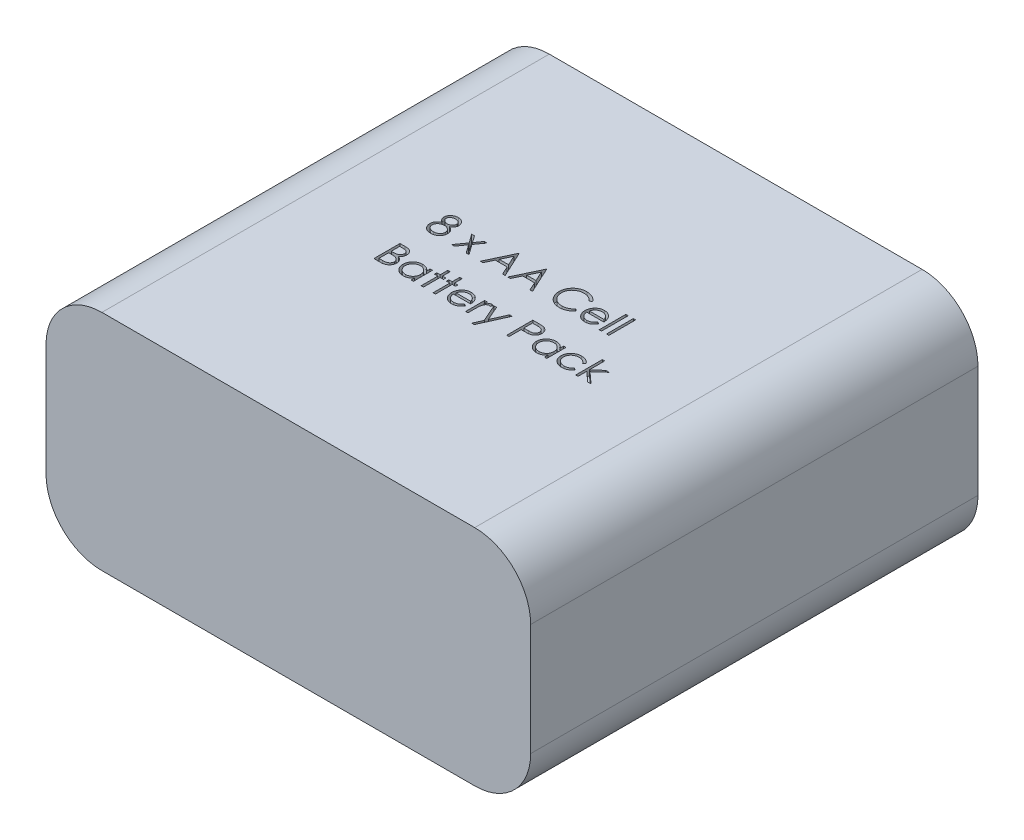
from build123d import *

# Parameters (mm, degrees)
SKETCH1_W           = 65
SKETCH1_H           = 30
BOSS_EXTRUDE1_DEPTH = 60
FILLET1_R           = 7.5
SKETCH2_W           = 0.314102564
SKETCH2_H           = 3.58974359
SKETCH2_W_2         = 0.314102565
CUT_EXTRUDE1_DEPTH  = 1


with BuildPart() as part:
    # Sketch1 → Boss-Extrude1 (new body)
    with BuildSketch(Plane.XY):
        with Locations((32.5, 15)):
            Rectangle(SKETCH1_W, SKETCH1_H)
    extrude(amount=-BOSS_EXTRUDE1_DEPTH)

    # Fillet1
    fillet1_edges = [part.edges().sort_by_distance(p)[0] for p in [
        (0, 0, -30),
        (0, 30, -30),
        (65, 0, -30),
        (65, 30, -30),
    ]]
    fillet(fillet1_edges, radius=FILLET1_R)

    # Sketch2 → Cut-Extrude1 (cut)
    # profile 1 of 19: a face of its own
    with BuildSketch(Plane(origin=(0, 30, 0), x_dir=(1, 0, 0), z_dir=(0, 1, 0))):
        with BuildLine():
            add(Edge.make_bspline(
                [(20.873721371, 33.275930928), (20.902369918, 33.260992972), (20.958244153, 33.23185897), (21.037821361, 33.184948142), (21.110546362, 33.135507177), (21.178436924, 33.085871318), (21.240300275, 33.034139666), (21.295444688, 32.98010651), (21.345232308, 32.925120565), (21.388659092, 32.868250725), (21.426855928, 32.809648075), (21.459868064, 32.749158802), (21.488085266, 32.686915469), (21.510448205, 32.622238639), (21.528869997, 32.556078377), (21.541545602, 32.487580395), (21.54836252, 32.417196054), (21.549651333, 32.369627753), (21.550303903, 32.345542307)],
                knots=[0, 0, 0, 0, 1.272397273, 2.481599622, 3.635517121, 4.734568067, 5.792894095, 6.808321871, 7.773003508, 8.711915296, 9.623354172, 10.525449501, 11.423591555, 12.311487226, 13.218079475, 14.126165749, 15.051214107, 16, 16, 16, 16], degree=3))
            add(Edge.make_bspline(
                [(21.550303903, 32.345542307), (21.549532483, 32.311844574), (21.548005552, 32.245144117), (21.534705568, 32.146698006), (21.514792589, 32.051086224), (21.485713077, 31.958329733), (21.447999686, 31.86894036), (21.40152285, 31.782841586), (21.348911645, 31.698622277), (21.306659406, 31.646802875), (21.285279865, 31.620582371)],
                knots=[0, 0, 0, 0, 1.025265484, 2.029385089, 3.018602448, 3.995076438, 4.983346944, 5.966715145, 6.97116228, 8, 8, 8, 8], degree=3))
            add(Edge.make_bspline(
                [(21.285279865, 31.620582371), (21.25744339, 31.589988597), (21.202114425, 31.529179104), (21.107331497, 31.450228294), (21.003309613, 31.3838789), (20.890451281, 31.329807005), (20.769058179, 31.287721146), (20.639156175, 31.257478628), (20.500492022, 31.240156199), (20.405186551, 31.23765221), (20.356293487, 31.236367627)],
                knots=[0, 0, 0, 0, 0.954267603, 1.896743057, 2.838368354, 3.796610408, 4.779680527, 5.799409237, 6.871065594, 8, 8, 8, 8], degree=3))
            add(Edge.make_bspline(
                [(20.356293487, 31.236367627), (20.309280098, 31.237520105), (20.217796819, 31.23976271), (20.084638941, 31.254957142), (19.960515872, 31.281585008), (19.844705903, 31.318029618), (19.73790721, 31.365439846), (19.640424109, 31.424448255), (19.550850136, 31.492679697), (19.471903663, 31.572093775), (19.401815219, 31.657151647), (19.340247166, 31.744903257), (19.289073087, 31.835356615), (19.245745992, 31.927162982), (19.212577969, 32.021609136), (19.189605759, 32.118209149), (19.175016445, 32.216794292), (19.17307531, 32.283325945), (19.172098775, 32.316796313)],
                knots=[0, 0, 0, 0, 1.256902934, 2.445805442, 3.576955095, 4.645999104, 5.686449165, 6.692658513, 7.68621702, 8.689161843, 9.678783111, 10.630372946, 11.551080876, 12.453998257, 13.34127905, 14.221779781, 15.105423033, 16, 16, 16, 16], degree=3))
            add(Edge.make_bspline(
                [(19.172098775, 32.316796313), (19.172676656, 32.341355505), (19.173818753, 32.389893137), (19.181723601, 32.461602465), (19.194432062, 32.5313986), (19.211691519, 32.599539344), (19.235082546, 32.665528616), (19.263324679, 32.72967909), (19.296256631, 32.792063189), (19.334337796, 32.85302207), (19.37863982, 32.911701582), (19.42880347, 32.969097577), (19.485831339, 33.024319444), (19.549088998, 33.078041869), (19.617853537, 33.131217843), (19.693911068, 33.180973571), (19.775245335, 33.230831536), (19.833050741, 33.260639861), (19.862703743, 33.275930928)],
                knots=[0, 0, 0, 0, 0.941657376, 1.861047343, 2.762797495, 3.66048619, 4.553285746, 5.444104102, 6.34607688, 7.256116206, 8.197091036, 9.162375105, 10.176350973, 11.237807142, 12.343728897, 13.50695164, 14.721116704, 16, 16, 16, 16], degree=3))
            add(Edge.make_bspline(
                [(19.862703743, 33.275930928), (19.822112368, 33.298065697), (19.743516105, 33.340924805), (19.639446664, 33.419671611), (19.550056041, 33.504959426), (19.477801323, 33.59858922), (19.420929095, 33.697636095), (19.381910491, 33.801480347), (19.355514007, 33.908196461), (19.352899179, 33.981102657), (19.351585954, 34.017717787)],
                knots=[0, 0, 0, 0, 1.166880483, 2.259407225, 3.286803203, 4.280235371, 5.237608625, 6.161067461, 7.076446754, 8, 8, 8, 8], degree=3))
            add(Edge.make_bspline(
                [(19.351585954, 34.017717787), (19.353221379, 34.055015346), (19.356508866, 34.129989943), (19.383092187, 34.241596066), (19.426412253, 34.351212631), (19.48533325, 34.458308344), (19.558720466, 34.559258559), (19.646767012, 34.649799505), (19.747370309, 34.729110987), (19.860028176, 34.79568716), (19.981264412, 34.849870819), (20.109180136, 34.887249242), (20.241546629, 34.911685358), (20.331644348, 34.914452013), (20.37732714, 34.915854807)],
                knots=[0, 0, 0, 0, 0.888701115, 1.786444228, 2.72001202, 3.692817113, 4.693886446, 5.687152267, 6.695133018, 7.739871481, 8.800368666, 9.853104506, 10.91144658, 12, 12, 12, 12], degree=3))
            add(Edge.make_bspline(
                [(20.37732714, 34.915854807), (20.421830955, 34.914408464), (20.509587408, 34.91155644), (20.638582036, 34.887769562), (20.762006914, 34.848040042), (20.879436412, 34.794142819), (20.98876828, 34.727755878), (21.085370589, 34.647355004), (21.170703171, 34.557213453), (21.241287565, 34.45629385), (21.299450455, 34.349609656), (21.339951356, 34.237987135), (21.36590333, 34.123838076), (21.369176694, 34.046600072), (21.370816724, 34.007902082)],
                knots=[0, 0, 0, 0, 1.072916533, 2.115669174, 3.151510826, 4.193348718, 5.225979165, 6.227137561, 7.216255879, 8.211077061, 9.189680878, 10.138522389, 11.067357538, 12, 12, 12, 12], degree=3))
            add(Edge.make_bspline(
                [(21.370816724, 34.007902082), (21.369382163, 33.969925418), (21.366564768, 33.895341409), (21.342864828, 33.786614889), (21.302951514, 33.68479285), (21.248457351, 33.588719898), (21.177431864, 33.5001384), (21.090823131, 33.41792193), (20.989321653, 33.341395102), (20.913060766, 33.298208737), (20.873721371, 33.275930928)],
                knots=[0, 0, 0, 0, 0.975232327, 1.915300861, 2.843280834, 3.77672583, 4.742871857, 5.749627742, 6.839139064, 8, 8, 8, 8], degree=3))
        make_face()
        with BuildLine():
            add(Edge.make_bspline(
                [(20.359799095, 34.556880448), (20.33524829, 34.556229007), (20.287216178, 34.554954505), (20.216787507, 34.548295868), (20.14981514, 34.535342651), (20.085599339, 34.518103939), (20.025020527, 34.494815951), (19.967255973, 34.467420942), (19.913288783, 34.434114876), (19.86246748, 34.396753678), (19.816716705, 34.355660772), (19.776112154, 34.312847054), (19.742384039, 34.267471662), (19.71374293, 34.220663302), (19.692961412, 34.171032726), (19.677397109, 34.120101549), (19.666875717, 34.067226165), (19.666087327, 34.031089655), (19.665688519, 34.012809935)],
                knots=[0, 0, 0, 0, 1.203892937, 2.355340988, 3.463153438, 4.544400666, 5.610487187, 6.640501085, 7.674077295, 8.714426146, 9.728707835, 10.68524104, 11.601827946, 12.495867327, 13.368432065, 14.231010473, 15.105153427, 16, 16, 16, 16], degree=3))
            add(Edge.make_bspline(
                [(19.665688519, 34.012809935), (19.666375885, 33.994529425), (19.667734221, 33.958404512), (19.678239349, 33.905058646), (19.693896204, 33.85263701), (19.718546865, 33.802386099), (19.748113224, 33.752562739), (19.7846047, 33.704412153), (19.828093728, 33.657766769), (19.877121168, 33.613023327), (19.930532706, 33.571124564), (19.987116749, 33.534751383), (20.04616314, 33.504317272), (20.10706521, 33.478987867), (20.170443657, 33.45929793), (20.235910131, 33.445329284), (20.303475633, 33.436647287), (20.349256214, 33.435610266), (20.372419288, 33.435085576)],
                knots=[0, 0, 0, 0, 0.873023192, 1.725219244, 2.590779336, 3.480155217, 4.391973325, 5.357036234, 6.360879153, 7.436073238, 8.526419356, 9.601555421, 10.645666583, 11.697338044, 12.750135903, 13.812665442, 14.89329948, 16, 16, 16, 16], degree=3))
            add(Edge.make_bspline(
                [(20.372419288, 33.435085576), (20.402169392, 33.435958443), (20.461375759, 33.437695556), (20.548655091, 33.45384673), (20.633517735, 33.479252647), (20.71505664, 33.514012614), (20.791161225, 33.557640474), (20.859001293, 33.609873492), (20.917998186, 33.669505589), (20.967538796, 33.735608425), (21.005948643, 33.805960013), (21.03585045, 33.876560306), (21.053311666, 33.948162537), (21.055589233, 33.996129501), (21.05671416, 34.019821153)],
                knots=[0, 0, 0, 0, 1.076279235, 2.141928126, 3.20205304, 4.278698113, 5.344010996, 6.36967002, 7.368914609, 8.37248503, 9.349703398, 10.264243087, 11.142681841, 12, 12, 12, 12], degree=3))
            add(Edge.make_bspline(
                [(21.05671416, 34.019821153), (21.056182262, 34.036449189), (21.055126522, 34.069453457), (21.046426466, 34.118191822), (21.032050633, 34.165821406), (21.012587553, 34.212735676), (20.986977758, 34.258276408), (20.95661357, 34.303159496), (20.919729069, 34.34637526), (20.878332635, 34.388930809), (20.831387227, 34.428314832), (20.778983315, 34.462949543), (20.721389564, 34.492361899), (20.658604614, 34.516250654), (20.59085969, 34.534193004), (20.518466816, 34.547629351), (20.440822369, 34.555202463), (20.387392618, 34.556308988), (20.359799095, 34.556880448)],
                knots=[0, 0, 0, 0, 0.814439003, 1.616544685, 2.417341072, 3.248991801, 4.09997495, 4.973547432, 5.9003056, 6.880240646, 7.880314356, 8.896779544, 9.951930927, 11.043077905, 12.18215768, 13.381699519, 14.647792085, 16, 16, 16, 16], degree=3))
        make_face(mode=Mode.SUBTRACT)
        with BuildLine():
            add(Edge.make_bspline(
                [(20.380131628, 33.076111217), (20.349005842, 33.075557576), (20.287944646, 33.074471466), (20.198487717, 33.062381966), (20.112634552, 33.045552573), (20.030674615, 33.020021734), (19.952642519, 32.986825244), (19.878115836, 32.946890704), (19.807664706, 32.899685261), (19.74226198, 32.845808645), (19.682538651, 32.787749191), (19.630140351, 32.726287056), (19.58564283, 32.662564523), (19.549809579, 32.595772294), (19.520397847, 32.527324683), (19.50108397, 32.455517088), (19.488702258, 32.381729975), (19.487039627, 32.331569876), (19.486201339, 32.306279486)],
                knots=[0, 0, 0, 0, 1.140299081, 2.23698856, 3.303958914, 4.344563908, 5.37730929, 6.408454204, 7.439741482, 8.480804886, 9.510774543, 10.48932336, 11.43758569, 12.353841022, 13.263987381, 14.161954604, 15.073269652, 16, 16, 16, 16], degree=3))
            add(Edge.make_bspline(
                [(19.486201339, 32.306279486), (19.487564598, 32.27484858), (19.490269271, 32.212490397), (19.51172591, 32.120327325), (19.546161446, 32.031106271), (19.594186662, 31.945554318), (19.653654234, 31.865604211), (19.726780702, 31.795915436), (19.80902154, 31.733993957), (19.903159394, 31.683913424), (20.00598786, 31.643918569), (20.117479589, 31.616362606), (20.236034508, 31.598121156), (20.3178941, 31.596282975), (20.359799095, 31.595341986)],
                knots=[0, 0, 0, 0, 0.898778495, 1.783155532, 2.693654817, 3.627872908, 4.583023416, 5.533784346, 6.509005473, 7.520592997, 8.575161974, 9.658835044, 10.801527049, 12, 12, 12, 12], degree=3))
            add(Edge.make_bspline(
                [(20.359799095, 31.595341986), (20.392549463, 31.595970795), (20.456357682, 31.597195915), (20.549443631, 31.608010209), (20.63728818, 31.625159834), (20.719720978, 31.65010338), (20.797664818, 31.680553356), (20.869798172, 31.719725438), (20.937976699, 31.764277761), (20.998840822, 31.817135917), (21.054274031, 31.873615412), (21.102607323, 31.933405455), (21.144564874, 31.994881088), (21.17749583, 32.059431572), (21.203822084, 32.125818487), (21.222745639, 32.194653998), (21.234421854, 32.266149231), (21.23560275, 32.314648302), (21.236201339, 32.33923221)],
                knots=[0, 0, 0, 0, 1.224942928, 2.386581632, 3.501229538, 4.569074225, 5.605009692, 6.626002462, 7.634866581, 8.645888296, 9.63523824, 10.59253846, 11.518950513, 12.414518923, 13.29783783, 14.186679152, 15.080837789, 16, 16, 16, 16], degree=3))
            add(Edge.make_bspline(
                [(21.236201339, 32.33923221), (21.235295491, 32.363109551), (21.233509315, 32.410191496), (21.222172624, 32.479958022), (21.202256747, 32.547360837), (21.17492935, 32.613210843), (21.138548387, 32.676173793), (21.095703517, 32.737889965), (21.044009399, 32.796646409), (20.985596803, 32.852899505), (20.921937842, 32.904915242), (20.854270697, 32.950929681), (20.783116235, 32.989681797), (20.708625024, 33.021198292), (20.630962468, 33.045985762), (20.55018569, 33.063301757), (20.466200115, 33.07420136), (20.409145244, 33.075467406), (20.380131628, 33.076111217)],
                knots=[0, 0, 0, 0, 0.917430815, 1.809013306, 2.70690318, 3.612392954, 4.541220862, 5.495268465, 6.494511384, 7.542276156, 8.608045339, 9.649016899, 10.681629292, 11.715607085, 12.752076957, 13.808767841, 14.885711793, 16, 16, 16, 16], degree=3))
        make_face(mode=Mode.SUBTRACT)
    # profile 2 of 19: a face of its own
    with BuildSketch(Plane(origin=(0, 30, 0), x_dir=(1, 0, 0), z_dir=(0, 1, 0))):
        Polygon((23.210560313, 33.883803525), (23.58425823, 33.883803525), (24.242611595, 32.961127243), (24.900964961, 33.883803525), (25.274662878, 33.883803525), (24.429811115, 32.699608813), (25.409278262, 31.326111217), (25.035580345, 31.326111217), (24.242611595, 32.437389262), (23.449642845, 31.326111217), (23.075944929, 31.326111217), (24.056113198, 32.699608813), align=None)
    # profile 3 of 19: a face of its own
    with BuildSketch(Plane(origin=(0, 30, 0), x_dir=(1, 0, 0), z_dir=(0, 1, 0))):
        Polygon((28.640047493, 34.826111217), (30.255432108, 31.326111217), (29.913985794, 31.326111217), (29.39655791, 32.447906089), (27.809919288, 32.447906089), (27.277767845, 31.326111217), (26.934919288, 31.326111217), (28.595175698, 34.826111217), align=None)
        Polygon((28.614105987, 34.14391971), (27.980291884, 32.806880448), (29.231093166, 32.806880448), align=None, mode=Mode.SUBTRACT)
    # profile 4 of 19: a face of its own
    with BuildSketch(Plane(origin=(0, 30, 0), x_dir=(1, 0, 0), z_dir=(0, 1, 0))):
        Polygon((32.319534672, 34.826111217), (33.934919288, 31.326111217), (33.593472974, 31.326111217), (33.076045089, 32.447906089), (31.489406467, 32.447906089), (30.957255025, 31.326111217), (30.614406467, 31.326111217), (32.274662878, 34.826111217), align=None)
        Polygon((32.293593166, 34.14391971), (31.659779063, 32.806880448), (32.910580345, 32.806880448), align=None, mode=Mode.SUBTRACT)
    # profile 5 of 19: a face of its own
    with BuildSketch(Plane(origin=(0, 30, 0), x_dir=(1, 0, 0), z_dir=(0, 1, 0))):
        with BuildLine():
            Line((39.140047493, 34.183883653), (38.865207749, 33.973547114))
            add(Edge.make_bspline(
                [(38.865207749, 33.973547114), (38.845601861, 33.996913084), (38.806654414, 34.04333), (38.743995212, 34.108509544), (38.678693569, 34.169574806), (38.610774448, 34.226816685), (38.539015328, 34.278233451), (38.465154529, 34.326504554), (38.387956484, 34.369772292), (38.281204749, 34.422235278), (38.141556901, 34.476981433), (37.965762062, 34.522884664), (37.782250964, 34.55210584), (37.657053364, 34.555270682), (37.593372813, 34.556880448)],
                knots=[0, 0, 0, 0, 0.757959112, 1.505699292, 2.245454638, 2.979532153, 3.711538275, 4.438200793, 5.171680507, 5.909471876, 7.393775596, 8.890124382, 10.418191784, 12, 12, 12, 12], degree=3))
            add(Edge.make_bspline(
                [(37.593372813, 34.556880448), (37.558289514, 34.556476485), (37.488448522, 34.555672309), (37.384800048, 34.545063184), (37.283086997, 34.530151974), (37.183375531, 34.508026651), (37.085792572, 34.480054032), (36.98970017, 34.446628618), (36.89648957, 34.405273778), (36.804871332, 34.359565518), (36.717092121, 34.307938073), (36.634037073, 34.251624721), (36.556009105, 34.191255625), (36.482946493, 34.126604519), (36.414774545, 34.057962558), (36.351987234, 33.984598217), (36.294801824, 33.906746043), (36.242084799, 33.825432635), (36.194872065, 33.740894844), (36.155342186, 33.652819773), (36.120337064, 33.56271567), (36.092637821, 33.469564509), (36.070713304, 33.374021744), (36.055585641, 33.275830956), (36.04509717, 33.175197276), (36.044296993, 33.106987963), (36.043893647, 33.072605608)],
                knots=[0, 0, 0, 0, 1.054917814, 2.100044995, 3.131103042, 4.146048494, 5.169673617, 6.183595914, 7.203665975, 8.234915748, 9.262203917, 10.264457458, 11.251630812, 12.227803204, 13.197192746, 14.159520551, 15.12972552, 16.100847026, 17.073214652, 18.039054194, 19.002613845, 19.979014051, 20.95965708, 21.949030935, 22.966165397, 24, 24, 24, 24], degree=3))
            add(Edge.make_bspline(
                [(36.043893647, 33.072605608), (36.045155466, 33.020874288), (36.04763288, 32.919306703), (36.069681214, 32.770536093), (36.103186305, 32.628015419), (36.153401882, 32.492635577), (36.215320933, 32.362727218), (36.293561544, 32.240488365), (36.384178082, 32.124071801), (36.488452501, 32.016228853), (36.602858317, 31.917715128), (36.725606229, 31.830964546), (36.856390517, 31.758649664), (36.993767147, 31.698473717), (37.138793261, 31.652216989), (37.291208063, 31.619652866), (37.450680058, 31.598410685), (37.559649458, 31.596376997), (37.615107589, 31.595341986)],
                knots=[0, 0, 0, 0, 1.029171465, 2.020641659, 2.987623507, 3.938342917, 4.889210282, 5.84687017, 6.821220943, 7.821438502, 8.827599549, 9.822697543, 10.807740252, 11.797342354, 12.80366471, 13.83203677, 14.896651826, 16, 16, 16, 16], degree=3))
            add(Edge.make_bspline(
                [(37.615107589, 31.595341986), (37.676210278, 31.597030766), (37.796474987, 31.600354688), (37.972843013, 31.628513938), (38.141678779, 31.674171855), (38.302991365, 31.738069778), (38.456326012, 31.821135066), (38.601922672, 31.921832943), (38.739904243, 32.041121276), (38.822875525, 32.132204404), (38.865207749, 32.178675319)],
                knots=[0, 0, 0, 0, 1.028121516, 2.023589091, 2.998037872, 3.967518031, 4.937445131, 5.927275754, 6.942489185, 8, 8, 8, 8], degree=3))
            Line((38.865207749, 32.178675319), (39.140047493, 31.970442146))
            add(Edge.make_bspline(
                [(39.140047493, 31.970442146), (39.117929383, 31.941903694), (39.073799108, 31.884963488), (39.002341091, 31.804691778), (38.927063793, 31.729187743), (38.847408083, 31.659060122), (38.764290292, 31.592905656), (38.676217979, 31.532603825), (38.584348947, 31.477312941), (38.488994468, 31.426686016), (38.390255855, 31.381768769), (38.28825142, 31.343315001), (38.183420845, 31.310190112), (38.075759336, 31.282938175), (37.96504358, 31.261667091), (37.851673105, 31.247447416), (37.73540323, 31.237705502), (37.656961809, 31.236817586), (37.617210954, 31.236367627)],
                knots=[0, 0, 0, 0, 0.986787822, 1.968848986, 2.935600012, 3.899624008, 4.868462664, 5.837806735, 6.815139263, 7.798259679, 8.787526145, 9.778297419, 10.776456485, 11.791383307, 12.812564526, 13.85620153, 14.913611965, 16, 16, 16, 16], degree=3))
            add(Edge.make_bspline(
                [(37.617210954, 31.236367627), (37.579567287, 31.23662962), (37.505131597, 31.237147678), (37.395232846, 31.245539845), (37.288243265, 31.256989582), (37.184468639, 31.274229713), (37.083342664, 31.294574053), (36.985782079, 31.32184531), (36.890826869, 31.352394476), (36.798858528, 31.388299463), (36.709798829, 31.428815645), (36.623935017, 31.474607204), (36.541306585, 31.525289069), (36.461101164, 31.579744079), (36.38450358, 31.639721381), (36.310850055, 31.704388016), (36.239727579, 31.773526027), (36.195724894, 31.82338088), (36.173601179, 31.848446954)],
                knots=[0, 0, 0, 0, 1.114604814, 2.203992996, 3.262667896, 4.300477797, 5.318619304, 6.316056647, 7.298880507, 8.271930387, 9.238335007, 10.195173496, 11.151986948, 12.108099108, 13.064862484, 14.031167946, 15.010108607, 16, 16, 16, 16], degree=3))
            add(Edge.make_bspline(
                [(36.173601179, 31.848446954), (36.138165535, 31.891988143), (36.067722058, 31.978544853), (35.977596375, 32.118830835), (35.90044882, 32.265299044), (35.838072899, 32.418718972), (35.789310166, 32.57874636), (35.755528971, 32.745461874), (35.733577366, 32.918709816), (35.731067077, 33.036546605), (35.729791083, 33.096443749)],
                knots=[0, 0, 0, 0, 0.994628077, 1.977248131, 2.950237994, 3.925870899, 4.908910175, 5.911660606, 6.938484602, 8, 8, 8, 8], degree=3))
            add(Edge.make_bspline(
                [(35.729791083, 33.096443749), (35.731346276, 33.159399203), (35.734406022, 33.283260127), (35.760401818, 33.46503408), (35.802220614, 33.639185479), (35.861617503, 33.805389224), (35.936922854, 33.964519504), (36.029949468, 34.115360709), (36.13961661, 34.258877509), (36.265064178, 34.39289226), (36.402631513, 34.515431612), (36.549950327, 34.623237816), (36.706732274, 34.712955332), (36.871250126, 34.787951495), (37.044735807, 34.845595958), (37.226819176, 34.885949144), (37.417158091, 34.911066261), (37.547020517, 34.914241469), (37.613004224, 34.915854807)],
                knots=[0, 0, 0, 0, 1.032925535, 2.032216505, 3.007276963, 3.968222605, 4.92396291, 5.891752235, 6.871517503, 7.883894988, 8.900124299, 9.891468569, 10.874487609, 11.85992873, 12.854644235, 13.869047385, 14.917252991, 16, 16, 16, 16], degree=3))
            add(Edge.make_bspline(
                [(37.613004224, 34.915854807), (37.653218696, 34.915372668), (37.732819193, 34.914418324), (37.850571845, 34.905112182), (37.965214172, 34.889598576), (38.076825154, 34.868482506), (38.185947771, 34.842275185), (38.291748011, 34.808134887), (38.394846698, 34.769098355), (38.494593606, 34.724139889), (38.590510157, 34.673673148), (38.682566475, 34.618257524), (38.770031334, 34.557961719), (38.853520182, 34.493298543), (38.931636393, 34.422899984), (39.006597872, 34.348702388), (39.07585895, 34.268568564), (39.118612145, 34.21216363), (39.140047493, 34.183883653)],
                knots=[0, 0, 0, 0, 1.096760587, 2.17092713, 3.219439832, 4.250915756, 5.268269357, 6.278326846, 7.281116186, 8.274029601, 9.260640565, 10.235837813, 11.203064059, 12.156899882, 13.114053108, 14.069676657, 15.032185724, 16, 16, 16, 16], degree=3))
        make_face()
    # profile 6 of 19: a face of its own
    with BuildSketch(Plane(origin=(0, 30, 0), x_dir=(1, 0, 0), z_dir=(0, 1, 0))):
        with BuildLine():
            Line((41.867411275, 32.133803525), (42.146457749, 31.987269069))
            add(Edge.make_bspline(
                [(42.146457749, 31.987269069), (42.124221154, 31.947825738), (42.080957546, 31.871084635), (42.006556798, 31.765652775), (41.928564725, 31.670805059), (41.843460757, 31.589075405), (41.753791078, 31.51782402), (41.659058423, 31.455486195), (41.558769606, 31.402367675), (41.452919881, 31.357615147), (41.34062033, 31.323205653), (41.221598813, 31.298901432), (41.095627318, 31.283878163), (41.009281138, 31.282133022), (40.965067525, 31.281239422)],
                knots=[0, 0, 0, 0, 1.120438281, 2.179929193, 3.190490725, 4.156257408, 5.095198341, 6.022838206, 6.959905092, 7.901321166, 8.864066838, 9.862729781, 10.905609505, 12, 12, 12, 12], degree=3))
            add(Edge.make_bspline(
                [(40.965067525, 31.281239422), (40.915925547, 31.282386597), (40.820063786, 31.284624404), (40.680524039, 31.303916869), (40.54914462, 31.335389227), (40.425932917, 31.379354769), (40.311190664, 31.436782093), (40.20468981, 31.506741575), (40.105870284, 31.588873829), (40.017846074, 31.683890273), (39.938602192, 31.78557223), (39.868676372, 31.891528115), (39.810218941, 32.001491339), (39.762666331, 32.114761863), (39.724261466, 32.230625757), (39.697494762, 32.350137224), (39.682065014, 32.472972808), (39.679700568, 32.556070144), (39.678509031, 32.597946153)],
                knots=[0, 0, 0, 0, 1.145258523, 2.234067595, 3.276747158, 4.290159414, 5.277019952, 6.260822364, 7.254936242, 8.264827045, 9.274100331, 10.257902744, 11.220704747, 12.172965371, 13.118907548, 14.062713208, 15.023725156, 16, 16, 16, 16], degree=3))
            add(Edge.make_bspline(
                [(39.678509031, 32.597946153), (39.679568173, 32.637240983), (39.681667251, 32.715118148), (39.694898038, 32.830383692), (39.718346331, 32.942412145), (39.750522655, 33.051296593), (39.792073902, 33.156854727), (39.842906121, 33.259150791), (39.903098499, 33.35807593), (39.949571172, 33.420479064), (39.972980185, 33.451912499)],
                knots=[0, 0, 0, 0, 1.024358464, 2.0301432, 3.019427413, 4.004406732, 4.986367066, 5.972626655, 6.978780325, 8, 8, 8, 8], degree=3))
            add(Edge.make_bspline(
                [(39.972980185, 33.451912499), (40.004687868, 33.489781369), (40.067098815, 33.564319519), (40.17265517, 33.662257845), (40.286955366, 33.74430162), (40.408566992, 33.812308757), (40.538903466, 33.863982404), (40.676212757, 33.902489986), (40.822058344, 33.924067997), (40.921763565, 33.92711583), (40.972779865, 33.928675319)],
                knots=[0, 0, 0, 0, 1.030682036, 2.02871468, 2.997146059, 3.962720338, 4.930598197, 5.918074684, 6.934738563, 8, 8, 8, 8], degree=3))
            add(Edge.make_bspline(
                [(40.972779865, 33.928675319), (41.02522747, 33.927321271), (41.128117716, 33.924664935), (41.278149837, 33.900038602), (41.420110554, 33.860986047), (41.553943058, 33.805832257), (41.679660919, 33.734672705), (41.796446968, 33.646530864), (41.906298481, 33.544112776), (41.97020706, 33.465349567), (42.002727781, 33.425269871)],
                knots=[0, 0, 0, 0, 1.056321875, 2.072262726, 3.055038591, 4.01806755, 4.982017516, 5.957941055, 6.960871419, 8, 8, 8, 8], degree=3))
            add(Edge.make_bspline(
                [(42.002727781, 33.425269871), (42.02485472, 33.395066289), (42.068961313, 33.334860171), (42.124208413, 33.236689014), (42.172165808, 33.133978419), (42.210498769, 33.025068122), (42.24153827, 32.911248542), (42.263995089, 32.791705997), (42.277164707, 32.666476086), (42.279753405, 32.58114953), (42.281073134, 32.537649678)],
                knots=[0, 0, 0, 0, 0.94817472, 1.890038105, 2.849395472, 3.817997239, 4.812318967, 5.836947057, 6.897266129, 8, 8, 8, 8], degree=3))
            Line((42.281073134, 32.537649678), (39.992611595, 32.537649678))
            add(Edge.make_bspline(
                [(39.992611595, 32.537649678), (39.994151202, 32.503949214), (39.997178776, 32.43767861), (40.011293919, 32.340707827), (40.033542693, 32.248334485), (40.064811755, 32.161251443), (40.102678601, 32.078321316), (40.149064317, 32.000159279), (40.204403871, 31.927121349), (40.266129571, 31.858554211), (40.334836666, 31.79749345), (40.407119413, 31.742841674), (40.484012978, 31.697036077), (40.564911062, 31.659856187), (40.649682847, 31.630749871), (40.738355042, 31.61088205), (40.830753158, 31.597574944), (40.893738892, 31.596095278), (40.925804704, 31.595341986)],
                knots=[0, 0, 0, 0, 1.094153842, 2.151609401, 3.174256925, 4.172055639, 5.149267565, 6.128595816, 7.11444997, 8.118368179, 9.117203808, 10.09244225, 11.054858984, 12.015122123, 12.976791628, 13.957293641, 14.960065497, 16, 16, 16, 16], degree=3))
            add(Edge.make_bspline(
                [(40.925804704, 31.595341986), (40.957155852, 31.595950043), (41.019362543, 31.597156544), (41.1120034, 31.608888455), (41.203142928, 31.62785873), (41.292403911, 31.65374872), (41.377974757, 31.685325573), (41.457220307, 31.72342843), (41.530100523, 31.765578177), (41.598217489, 31.813787852), (41.664288483, 31.872796039), (41.729830969, 31.94643176), (41.800107622, 32.033519288), (41.844097215, 32.099064954), (41.867411275, 32.133803525)],
                knots=[0, 0, 0, 0, 0.99110716, 1.966546729, 2.947904876, 3.932708344, 4.903319531, 5.828989031, 6.710028674, 7.56322171, 8.463672341, 9.504779593, 10.677557249, 12, 12, 12, 12], degree=3))
        make_face()
        with BuildLine():
            add(Edge.make_bspline(
                [(41.96697057, 32.851752243), (41.955473945, 32.893415116), (41.933346644, 32.973602737), (41.887110279, 33.084643627), (41.835038739, 33.183331528), (41.773417007, 33.268911161), (41.703598282, 33.344914674), (41.622953099, 33.41133326), (41.532517206, 33.470750711), (41.432758065, 33.52090321), (41.32711628, 33.563593069), (41.216510088, 33.592218185), (41.1036523, 33.611827727), (41.027318014, 33.613653835), (40.988905666, 33.614572755)],
                knots=[0, 0, 0, 0, 1.154881502, 2.222775134, 3.210006277, 4.132804581, 5.035138423, 5.962687519, 6.919655026, 7.923214229, 8.944639381, 9.960483929, 10.97369054, 12, 12, 12, 12], degree=3))
            add(Edge.make_bspline(
                [(40.988905666, 33.614572755), (40.957556227, 33.613961084), (40.895584978, 33.612751938), (40.80428391, 33.601281808), (40.716604211, 33.582321964), (40.631898924, 33.556357007), (40.551278055, 33.521748404), (40.473083287, 33.481165178), (40.399302891, 33.431623594), (40.353161595, 33.393864739), (40.329851179, 33.374789102)],
                knots=[0, 0, 0, 0, 1.04873581, 2.073130211, 3.073294108, 4.04793562, 5.032784715, 6.005352987, 6.992311501, 8, 8, 8, 8], degree=3))
            add(Edge.make_bspline(
                [(40.329851179, 33.374789102), (40.313157897, 33.359694786), (40.279374763, 33.32914757), (40.234234241, 33.276518363), (40.191013768, 33.219766801), (40.151680116, 33.156721677), (40.115602529, 33.088100898), (40.081842552, 33.014483262), (40.05145614, 32.935310132), (40.03436003, 32.880137693), (40.02556432, 32.851752243)],
                knots=[0, 0, 0, 0, 0.879870761, 1.780643979, 2.707998968, 3.669668524, 4.684282772, 5.740141944, 6.837334558, 8, 8, 8, 8], degree=3))
            Line((40.02556432, 32.851752243), (41.96697057, 32.851752243))
        make_face(mode=Mode.SUBTRACT)
    # profile 7 of 19: a face of its own
    with BuildSketch(Plane(origin=(0, 30, 0), x_dir=(1, 0, 0), z_dir=(0, 1, 0))):
        with Locations((43.021457749, 33.120983012)):
            Rectangle(SKETCH2_W, SKETCH2_H)
    # profile 8 of 19: a face of its own
    with BuildSketch(Plane(origin=(0, 30, 0), x_dir=(1, 0, 0), z_dir=(0, 1, 0))):
        with Locations((44.008637237, 33.120983012)):
            Rectangle(SKETCH2_W_2, SKETCH2_H)
    # profile 9 of 19: a face of its own
    with BuildSketch(Plane(origin=(0, 30, 0), x_dir=(1, 0, 0), z_dir=(0, 1, 0))):
        with BuildLine():
            Line((19.486201339, 27.992777884), (20.169093967, 27.992777884))
            add(Edge.make_bspline(
                [(20.169093967, 27.992777884), (20.202522445, 27.992602133), (20.267315156, 27.992261485), (20.361534598, 27.986978354), (20.449783408, 27.979774684), (20.532087181, 27.968344591), (20.608407883, 27.954552814), (20.67897552, 27.937850998), (20.743565693, 27.917824385), (20.820678429, 27.885978103), (20.90859909, 27.838654935), (21.003797482, 27.76872637), (21.085201722, 27.683193907), (21.155388039, 27.586711251), (21.211189159, 27.48057548), (21.251558456, 27.367316291), (21.277116331, 27.248394549), (21.279744766, 27.166751371), (21.281073134, 27.125490223)],
                knots=[0, 0, 0, 0, 1.001505555, 1.941167018, 2.826882275, 3.653841531, 4.429895133, 5.150066043, 5.825578002, 6.45369114, 7.647487171, 8.808567382, 9.977351308, 11.170798116, 12.373658725, 13.556498008, 14.765093433, 16, 16, 16, 16], degree=3))
            add(Edge.make_bspline(
                [(21.281073134, 27.125490223), (21.279979915, 27.086837668), (21.277831638, 27.010881751), (21.257288879, 26.899787641), (21.22512821, 26.794036423), (21.180422961, 26.694014037), (21.122320965, 26.601980424), (21.053462646, 26.517193158), (20.970385844, 26.443242101), (20.908142604, 26.401899198), (20.876525858, 26.380898877)],
                knots=[0, 0, 0, 0, 1.044552857, 2.05264487, 3.044412934, 4.028983338, 5.005914585, 5.980388656, 6.974128949, 8, 8, 8, 8], degree=3))
            add(Edge.make_bspline(
                [(20.876525858, 26.380898877), (20.916286286, 26.365633878), (20.992357833, 26.336428154), (21.097043846, 26.28479269), (21.187238691, 26.228630579), (21.263635837, 26.167298729), (21.328973492, 26.101189919), (21.386026433, 26.029334804), (21.434707807, 25.950796046), (21.476420731, 25.866392511), (21.508969487, 25.776986043), (21.533345391, 25.683415267), (21.54731284, 25.586015711), (21.549300482, 25.519730332), (21.550303903, 25.486267467)],
                knots=[0, 0, 0, 0, 1.27268992, 2.434971085, 3.483601985, 4.442670788, 5.356604649, 6.2567628, 7.179492994, 8.113709626, 9.066344395, 10.018646069, 10.999752585, 12, 12, 12, 12], degree=3))
            add(Edge.make_bspline(
                [(21.550303903, 25.486267467), (21.549327057, 25.452100595), (21.547405085, 25.384876317), (21.533225113, 25.286121182), (21.509216006, 25.191746236), (21.47614486, 25.101141053), (21.432982545, 25.014480918), (21.380454581, 24.931667654), (21.317823018, 24.853533324), (21.247760149, 24.779209701), (21.168498003, 24.712381913), (21.082982248, 24.652866207), (20.990135928, 24.603920145), (20.891483934, 24.562804123), (20.785919618, 24.531396925), (20.673917011, 24.509424351), (20.555572709, 24.494619314), (20.474362958, 24.493402109), (20.432715762, 24.492777884)],
                knots=[0, 0, 0, 0, 0.978564426, 1.925352924, 2.850884081, 3.763762016, 4.682927383, 5.618979971, 6.567305752, 7.547517671, 8.540179244, 9.531824382, 10.526200242, 11.540722885, 12.589160233, 13.674978461, 14.80764778, 16, 16, 16, 16], degree=3))
            Line((20.432715762, 24.492777884), (19.486201339, 24.492777884))
            Line((19.486201339, 24.492777884), (19.486201339, 27.992777884))
        make_face()
        with BuildLine():
            Line((19.800303903, 27.633803525), (19.800303903, 26.512008653))
            Line((19.800303903, 26.512008653), (20.011341563, 26.512008653))
            add(Edge.make_bspline(
                [(20.011341563, 26.512008653), (20.042190359, 26.512408576), (20.101796518, 26.513181309), (20.188116415, 26.515394826), (20.268241433, 26.521592869), (20.342033266, 26.527789131), (20.40937571, 26.537863719), (20.470119571, 26.549855842), (20.525218168, 26.562538747), (20.588757714, 26.584108234), (20.660830662, 26.615985909), (20.737663766, 26.665457745), (20.805398236, 26.724382098), (20.862595424, 26.79237306), (20.909406894, 26.867239246), (20.941920609, 26.947786126), (20.963967894, 27.032006258), (20.965959425, 27.089824511), (20.96697057, 27.119180127)],
                knots=[0, 0, 0, 0, 1.156816544, 2.235205308, 3.236616184, 4.169592532, 5.011045266, 5.787822928, 6.49130361, 7.128639758, 8.301311294, 9.436451833, 10.541879658, 11.654887649, 12.756523258, 13.837046038, 14.901820046, 16, 16, 16, 16], degree=3))
            add(Edge.make_bspline(
                [(20.96697057, 27.119180127), (20.96644439, 27.138605899), (20.96541223, 27.176711671), (20.956958927, 27.232261025), (20.942591353, 27.284504777), (20.924137059, 27.334158888), (20.898348371, 27.379670738), (20.867984907, 27.422613934), (20.831299217, 27.461526052), (20.789541905, 27.497895551), (20.741533282, 27.530140078), (20.68730199, 27.558380841), (20.626114313, 27.581121618), (20.559001458, 27.601037771), (20.48493037, 27.615026064), (20.404755817, 27.626679452), (20.317821098, 27.632612194), (20.257675995, 27.633397557), (20.226585954, 27.633803525)],
                knots=[0, 0, 0, 0, 0.91205012, 1.789085906, 2.630437955, 3.453916878, 4.269457761, 5.079663411, 5.91843418, 6.774407191, 7.675494373, 8.627863946, 9.638891023, 10.736472738, 11.911756761, 13.175263542, 14.539845004, 16, 16, 16, 16], degree=3))
            Line((20.226585954, 27.633803525), (19.800303903, 27.633803525))
        make_face(mode=Mode.SUBTRACT)
        with BuildLine():
            Line((19.800303903, 26.153034294), (19.800303903, 24.851752243))
            Line((19.800303903, 24.851752243), (20.247619608, 24.851752243))
            add(Edge.make_bspline(
                [(20.247619608, 24.851752243), (20.279638534, 24.85213599), (20.341350793, 24.852875612), (20.430452023, 24.855290167), (20.513035127, 24.860782443), (20.588723262, 24.869428292), (20.658333715, 24.878806742), (20.721031418, 24.891418022), (20.777324612, 24.905866983), (20.842598919, 24.928201155), (20.916102428, 24.962897626), (20.995313284, 25.015211853), (21.065739502, 25.07753516), (21.125544761, 25.149666075), (21.17455775, 25.228097401), (21.210213205, 25.311242751), (21.232204062, 25.397728279), (21.234866231, 25.456694991), (21.236201339, 25.486267467)],
                knots=[0, 0, 0, 0, 1.160039823, 2.235823828, 3.228722157, 4.157150951, 4.99529583, 5.772374946, 6.472645482, 7.099169577, 8.269452708, 9.405989375, 10.527446681, 11.663510218, 12.788923519, 13.866172445, 14.929861265, 16, 16, 16, 16], degree=3))
            add(Edge.make_bspline(
                [(21.236201339, 25.486267467), (21.235925235, 25.504760807), (21.23537748, 25.541449189), (21.227116865, 25.595365008), (21.215102995, 25.647590882), (21.199571561, 25.698268622), (21.176952094, 25.746481999), (21.150545549, 25.793184558), (21.119584147, 25.838438037), (21.071339981, 25.895650291), (21.001167997, 25.961567304), (20.901461221, 26.026104806), (20.788088923, 26.078152613), (20.705861431, 26.10025209), (20.663384833, 26.111668108)],
                knots=[0, 0, 0, 0, 0.723448775, 1.435228256, 2.130040452, 2.821711965, 3.505591119, 4.210454504, 4.921174351, 5.648778258, 7.137944449, 8.670945889, 10.280296675, 12, 12, 12, 12], degree=3))
            add(Edge.make_bspline(
                [(20.663384833, 26.111668108), (20.646355737, 26.115123192), (20.609433144, 26.122614527), (20.549225564, 26.13052223), (20.480489695, 26.13756729), (20.403066818, 26.142778448), (20.316858977, 26.148164991), (20.221682058, 26.150259812), (20.117924743, 26.152759072), (20.045932371, 26.152940207), (20.008537076, 26.153034294)],
                knots=[0, 0, 0, 0, 0.634451884, 1.375622551, 2.216452059, 3.157844607, 4.20941857, 5.370758133, 6.634282058, 8, 8, 8, 8], degree=3))
            Line((20.008537076, 26.153034294), (19.800303903, 26.153034294))
        make_face(mode=Mode.SUBTRACT)
    # profile 10 of 19: a face of its own
    with BuildSketch(Plane(origin=(0, 30, 0), x_dir=(1, 0, 0), z_dir=(0, 1, 0))):
        with BuildLine():
            Line((24.781073134, 27.050470191), (24.781073134, 24.492777884))
            Line((24.781073134, 24.492777884), (24.46697057, 24.492777884))
            Line((24.46697057, 24.492777884), (24.46697057, 24.935185736))
            add(Edge.make_bspline(
                [(24.46697057, 24.935185736), (24.431551779, 24.895146142), (24.362431564, 24.817008371), (24.246990446, 24.714926199), (24.124622268, 24.630547877), (23.995920947, 24.562397961), (23.861002704, 24.511205905), (23.720166616, 24.474819746), (23.573355235, 24.451425911), (23.473102881, 24.449089889), (23.422299095, 24.447906089)],
                knots=[0, 0, 0, 0, 1.074387032, 2.096679803, 3.090159297, 4.057316773, 5.018401886, 5.985159533, 6.978961417, 8, 8, 8, 8], degree=3))
            add(Edge.make_bspline(
                [(23.422299095, 24.447906089), (23.377131142, 24.449132461), (23.288057937, 24.451550921), (23.15702886, 24.470313225), (23.03093661, 24.500443847), (22.909662038, 24.542344736), (22.793989892, 24.597925558), (22.682929795, 24.664466806), (22.577057103, 24.743707636), (22.477985564, 24.834295664), (22.386753564, 24.932690651), (22.306692291, 25.037636198), (22.239939212, 25.148678502), (22.184119131, 25.264411656), (22.141122786, 25.385726576), (22.111149152, 25.512203744), (22.092408705, 25.643693617), (22.089991245, 25.73323314), (22.088765442, 25.778635255)],
                knots=[0, 0, 0, 0, 1.033919861, 2.038935746, 3.024066025, 3.998881131, 4.97069526, 5.957263378, 6.95902576, 7.993208707, 9.027059324, 10.027763471, 11.009749337, 11.988697705, 12.965288445, 13.950418724, 14.960734635, 16, 16, 16, 16], degree=3))
            add(Edge.make_bspline(
                [(22.088765442, 25.778635255), (22.090018413, 25.823098959), (22.09249547, 25.911001302), (22.11094869, 26.04028), (22.141979698, 26.164798261), (22.185527546, 26.284155204), (22.241369501, 26.398495254), (22.309297588, 26.507899279), (22.389316713, 26.612668677), (22.48156912, 26.710339904), (22.58150389, 26.800560518), (22.688412621, 26.878969563), (22.799635902, 26.946686412), (22.916898913, 27.000339888), (23.038466017, 27.043748993), (23.165419463, 27.073781961), (23.297231042, 27.091479282), (23.386721534, 27.094042047), (23.432114801, 27.095341986)],
                knots=[0, 0, 0, 0, 1.020392517, 2.01726096, 2.990465484, 3.961182959, 4.928053699, 5.906110375, 6.912531644, 7.948652711, 8.985773172, 9.998621852, 10.987621588, 11.969261332, 12.953316658, 13.946091881, 14.958173133, 16, 16, 16, 16], degree=3))
            add(Edge.make_bspline(
                [(23.432114801, 27.095341986), (23.48431466, 27.093904235), (23.58667612, 27.091084872), (23.736404129, 27.067622144), (23.878048607, 27.027983677), (24.012702959, 26.974066179), (24.139883645, 26.90241745), (24.258386629, 26.812037489), (24.369452113, 26.703496302), (24.433832404, 26.620125858), (24.46697057, 26.57721298)],
                knots=[0, 0, 0, 0, 1.038897134, 2.037228247, 3.008116434, 3.962042015, 4.918381754, 5.904844433, 6.921570401, 8, 8, 8, 8], degree=3))
            Line((24.46697057, 26.57721298), (24.46697057, 27.050470191))
            Line((24.46697057, 27.050470191), (24.781073134, 27.050470191))
        make_face()
        with BuildLine():
            add(Edge.make_bspline(
                [(23.436321531, 26.781239422), (23.390407193, 26.779605784), (23.299779594, 26.776381243), (23.166735591, 26.751207748), (23.039422177, 26.709323154), (22.918476103, 26.652041253), (22.805807886, 26.580012516), (22.705114216, 26.492891133), (22.615571514, 26.393054118), (22.54026325, 26.280952008), (22.478872753, 26.160773917), (22.435705721, 26.035149479), (22.407236474, 25.906344501), (22.404327953, 25.818981816), (22.402868006, 25.775129646)],
                knots=[0, 0, 0, 0, 1.031046209, 2.035121221, 3.029706178, 4.034933723, 5.034054252, 6.02443088, 7.017295772, 8.038157696, 9.050218397, 10.03989886, 11.016116709, 12, 12, 12, 12], degree=3))
            add(Edge.make_bspline(
                [(22.402868006, 25.775129646), (22.404732899, 25.731539539), (22.408455376, 25.644530183), (22.43520607, 25.515549607), (22.480085944, 25.389895565), (22.541328006, 25.268634571), (22.618014631, 25.156050471), (22.706903284, 25.054310348), (22.808853565, 24.96682076), (22.921781072, 24.893583186), (23.042389043, 24.834420665), (23.169222974, 24.793255026), (23.299898612, 24.766677245), (23.388750946, 24.763572768), (23.433517044, 24.762008653)],
                knots=[0, 0, 0, 0, 0.979072187, 1.954306742, 2.945804271, 3.96968567, 4.997920485, 5.998718438, 6.996577872, 8.005894225, 9.015743152, 10.005417472, 10.995077863, 12, 12, 12, 12], degree=3))
            add(Edge.make_bspline(
                [(23.433517044, 24.762008653), (23.478963547, 24.763668617), (23.569352133, 24.76697012), (23.702790841, 24.792251386), (23.832285804, 24.834020184), (23.956073033, 24.891919311), (24.071389164, 24.963676667), (24.174887041, 25.047683758), (24.26240301, 25.145386942), (24.336595619, 25.252763395), (24.394771036, 25.370475391), (24.437147095, 25.495809582), (24.462201001, 25.62877033), (24.465358731, 25.719634257), (24.46697057, 25.766015063)],
                knots=[0, 0, 0, 0, 1.01762866, 2.023962475, 3.030623092, 4.058876274, 5.077231937, 6.066672613, 7.034107872, 8.005628644, 8.981990164, 9.965428785, 10.961468474, 12, 12, 12, 12], degree=3))
            add(Edge.make_bspline(
                [(24.46697057, 25.766015063), (24.466010913, 25.801352894), (24.464122006, 25.870908927), (24.449691437, 25.973036444), (24.42673651, 26.070770171), (24.39439034, 26.16421286), (24.351899056, 26.252847875), (24.30065129, 26.337311635), (24.23974584, 26.417164847), (24.170163144, 26.491307918), (24.093997941, 26.55893438), (24.013403401, 26.619298621), (23.927424654, 26.668887393), (23.837507617, 26.709928665), (23.743496282, 26.742587815), (23.644625663, 26.764375508), (23.541946676, 26.779335829), (23.47190062, 26.78059821), (23.436321531, 26.781239422)],
                knots=[0, 0, 0, 0, 1.050140795, 2.067009409, 3.05949893, 4.030605086, 5.00011959, 5.97591094, 6.962425594, 7.979863591, 8.993523472, 9.986985069, 10.967611495, 11.937549037, 12.921786183, 13.919465291, 14.943216303, 16, 16, 16, 16], degree=3))
        make_face(mode=Mode.SUBTRACT)
    # profile 11 of 19: a face of its own
    with BuildSketch(Plane(origin=(0, 30, 0), x_dir=(1, 0, 0), z_dir=(0, 1, 0))):
        Polygon((25.813124416, 28.082521473), (26.12722698, 28.082521473), (26.12722698, 27.050470191), (26.575944929, 27.050470191), (26.575944929, 26.736367627), (26.12722698, 26.736367627), (26.12722698, 24.492777884), (25.813124416, 24.492777884), (25.813124416, 26.736367627), (25.364406467, 26.736367627), (25.364406467, 27.050470191), (25.813124416, 27.050470191), align=None)
    # profile 12 of 19: a face of its own
    with BuildSketch(Plane(origin=(0, 30, 0), x_dir=(1, 0, 0), z_dir=(0, 1, 0))):
        Polygon((27.428509031, 28.082521473), (27.742611595, 28.082521473), (27.742611595, 27.050470191), (28.191329544, 27.050470191), (28.191329544, 26.736367627), (27.742611595, 26.736367627), (27.742611595, 24.492777884), (27.428509031, 24.492777884), (27.428509031, 26.736367627), (26.979791083, 26.736367627), (26.979791083, 27.050470191), (27.428509031, 27.050470191), align=None)
    # profile 13 of 19: a face of its own
    with BuildSketch(Plane(origin=(0, 30, 0), x_dir=(1, 0, 0), z_dir=(0, 1, 0))):
        with BuildLine():
            Line((30.828949737, 25.300470191), (31.107996211, 25.153935736))
            add(Edge.make_bspline(
                [(31.107996211, 25.153935736), (31.085759616, 25.114492405), (31.042496007, 25.037751302), (30.968095259, 24.932319442), (30.890103187, 24.837471726), (30.804999219, 24.755742071), (30.71532954, 24.684490686), (30.620596885, 24.622152862), (30.520308067, 24.569034341), (30.414458342, 24.524281814), (30.302158791, 24.489872319), (30.183137275, 24.465568099), (30.057165779, 24.45054483), (29.9708196, 24.448799689), (29.926605987, 24.447906089)],
                knots=[0, 0, 0, 0, 1.120438281, 2.179929193, 3.190490725, 4.156257408, 5.095198341, 6.022838206, 6.959905092, 7.901321166, 8.864066838, 9.862729781, 10.905609505, 12, 12, 12, 12], degree=3))
            add(Edge.make_bspline(
                [(29.926605987, 24.447906089), (29.877464009, 24.449053264), (29.781602247, 24.451291071), (29.6420625, 24.470583535), (29.510683082, 24.502055894), (29.387471378, 24.546021435), (29.272729126, 24.603448759), (29.166228271, 24.673408241), (29.067408745, 24.755540496), (28.979384536, 24.850556939), (28.900140653, 24.952238897), (28.830214833, 25.058194781), (28.771757402, 25.168158006), (28.724204792, 25.28142853), (28.685799927, 25.397292423), (28.659033223, 25.516803891), (28.643603475, 25.639639475), (28.64123903, 25.722736811), (28.640047493, 25.764612819)],
                knots=[0, 0, 0, 0, 1.145258523, 2.234067595, 3.276747158, 4.290159414, 5.277019952, 6.260822364, 7.254936242, 8.264827045, 9.274100331, 10.257902744, 11.220704747, 12.172965371, 13.118907548, 14.062713208, 15.023725156, 16, 16, 16, 16], degree=3))
            add(Edge.make_bspline(
                [(28.640047493, 25.764612819), (28.641106634, 25.80390765), (28.643205712, 25.881784815), (28.6564365, 25.997050359), (28.679884793, 26.109078812), (28.712061117, 26.21796326), (28.753612363, 26.323521394), (28.804444582, 26.425817457), (28.86463696, 26.524742597), (28.911109634, 26.587145731), (28.934518647, 26.618579166)],
                knots=[0, 0, 0, 0, 1.024358464, 2.0301432, 3.019427413, 4.004406732, 4.986367066, 5.972626655, 6.978780325, 8, 8, 8, 8], degree=3))
            add(Edge.make_bspline(
                [(28.934518647, 26.618579166), (28.96622633, 26.656448036), (29.028637276, 26.730986186), (29.134193631, 26.828924512), (29.248493828, 26.910968287), (29.370105454, 26.978975423), (29.500441928, 27.03064907), (29.637751219, 27.069156652), (29.783596805, 27.090734664), (29.883302026, 27.093782497), (29.934318326, 27.095341986)],
                knots=[0, 0, 0, 0, 1.030682036, 2.02871468, 2.997146059, 3.962720338, 4.930598197, 5.918074684, 6.934738563, 8, 8, 8, 8], degree=3))
            add(Edge.make_bspline(
                [(29.934318326, 27.095341986), (29.986765932, 27.093987937), (30.089656177, 27.091331602), (30.239688299, 27.066705269), (30.381649015, 27.027652714), (30.515481519, 26.972498924), (30.64119938, 26.901339372), (30.75798543, 26.81319753), (30.867836942, 26.710779443), (30.931745521, 26.632016234), (30.964266243, 26.591936537)],
                knots=[0, 0, 0, 0, 1.056321875, 2.072262726, 3.055038591, 4.01806755, 4.982017516, 5.957941055, 6.960871419, 8, 8, 8, 8], degree=3))
            add(Edge.make_bspline(
                [(30.964266243, 26.591936537), (30.986393181, 26.561732956), (31.030499774, 26.501526837), (31.085746874, 26.40335568), (31.133704269, 26.300645086), (31.17203723, 26.191734789), (31.203076732, 26.077915209), (31.22553355, 25.958372664), (31.238703169, 25.833142753), (31.241291866, 25.747816197), (31.242611595, 25.704316345)],
                knots=[0, 0, 0, 0, 0.94817472, 1.890038105, 2.849395472, 3.817997239, 4.812318967, 5.836947057, 6.897266129, 8, 8, 8, 8], degree=3))
            Line((31.242611595, 25.704316345), (28.954150057, 25.704316345))
            add(Edge.make_bspline(
                [(28.954150057, 25.704316345), (28.955689663, 25.670615881), (28.958717237, 25.604345277), (28.972832381, 25.507374494), (28.995081154, 25.415001152), (29.026350217, 25.32791811), (29.064217062, 25.244987982), (29.110602779, 25.166825945), (29.165942333, 25.093788015), (29.227668032, 25.025220878), (29.296375128, 24.964160117), (29.368657875, 24.90950834), (29.44555144, 24.863702744), (29.526449523, 24.826522854), (29.611221309, 24.797416538), (29.699893504, 24.777548717), (29.79229162, 24.76424161), (29.855277354, 24.762761945), (29.887343166, 24.762008653)],
                knots=[0, 0, 0, 0, 1.094153842, 2.151609401, 3.174256925, 4.172055639, 5.149267565, 6.128595816, 7.11444997, 8.118368179, 9.117203808, 10.09244225, 11.054858984, 12.015122123, 12.976791628, 13.957293641, 14.960065497, 16, 16, 16, 16], degree=3))
            add(Edge.make_bspline(
                [(29.887343166, 24.762008653), (29.918694314, 24.762616709), (29.980901005, 24.763823211), (30.073541862, 24.775555121), (30.164681389, 24.794525397), (30.253942373, 24.820415387), (30.339513218, 24.851992239), (30.418758769, 24.890095097), (30.491638984, 24.932244844), (30.559755951, 24.980454519), (30.625826944, 25.039462706), (30.69136943, 25.113098427), (30.761646084, 25.200185954), (30.805635677, 25.26573162), (30.828949737, 25.300470191)],
                knots=[0, 0, 0, 0, 0.99110716, 1.966546729, 2.947904876, 3.932708344, 4.903319531, 5.828989031, 6.710028674, 7.56322171, 8.463672341, 9.504779593, 10.677557249, 12, 12, 12, 12], degree=3))
        make_face()
        with BuildLine():
            add(Edge.make_bspline(
                [(30.928509031, 26.018418909), (30.917012407, 26.060081783), (30.894885105, 26.140269404), (30.848648741, 26.251310294), (30.7965772, 26.349998195), (30.734955469, 26.435577828), (30.665136743, 26.511581341), (30.584491561, 26.577999926), (30.494055667, 26.637417377), (30.394296526, 26.687569877), (30.288654741, 26.730259735), (30.178048549, 26.758884851), (30.065190761, 26.778494393), (29.988856475, 26.780320502), (29.950444128, 26.781239422)],
                knots=[0, 0, 0, 0, 1.154881502, 2.222775134, 3.210006277, 4.132804581, 5.035138423, 5.962687519, 6.919655026, 7.923214229, 8.944639381, 9.960483929, 10.97369054, 12, 12, 12, 12], degree=3))
            add(Edge.make_bspline(
                [(29.950444128, 26.781239422), (29.919094689, 26.78062775), (29.85712344, 26.779418604), (29.765822372, 26.767948475), (29.678142673, 26.74898863), (29.593437385, 26.723023674), (29.512816517, 26.688415071), (29.434621749, 26.647831845), (29.360841352, 26.598290261), (29.314700057, 26.560531406), (29.29138964, 26.541455768)],
                knots=[0, 0, 0, 0, 1.04873581, 2.073130211, 3.073294108, 4.04793562, 5.032784715, 6.005352987, 6.992311501, 8, 8, 8, 8], degree=3))
            add(Edge.make_bspline(
                [(29.29138964, 26.541455768), (29.274696358, 26.526361453), (29.240913224, 26.495814237), (29.195772703, 26.44318503), (29.15255223, 26.386433468), (29.113218577, 26.323388343), (29.077140991, 26.254767564), (29.043381014, 26.181149929), (29.012994602, 26.101976799), (28.995898491, 26.046804359), (28.987102781, 26.018418909)],
                knots=[0, 0, 0, 0, 0.879870761, 1.780643979, 2.707998968, 3.669668524, 4.684282772, 5.740141944, 6.837334558, 8, 8, 8, 8], degree=3))
            Line((28.987102781, 26.018418909), (30.928509031, 26.018418909))
        make_face(mode=Mode.SUBTRACT)
    # profile 14 of 19: a face of its own
    with BuildSketch(Plane(origin=(0, 30, 0), x_dir=(1, 0, 0), z_dir=(0, 1, 0))):
        with BuildLine():
            Line((31.781073134, 27.050470191), (32.095175698, 27.050470191))
            Line((32.095175698, 27.050470191), (32.095175698, 26.673967787))
            add(Edge.make_bspline(
                [(32.095175698, 26.673967787), (32.118364457, 26.709023616), (32.162712778, 26.776067615), (32.236425707, 26.864736916), (32.311929038, 26.938151963), (32.389584226, 26.996655481), (32.469962326, 27.0404686), (32.551299277, 27.072561635), (32.634874747, 27.091538951), (32.691036671, 27.094072609), (32.719174095, 27.095341986)],
                knots=[0, 0, 0, 0, 1.2804753, 2.448899062, 3.506932113, 4.484331642, 5.4025378, 6.288909075, 7.142734305, 8, 8, 8, 8], degree=3))
            add(Edge.make_bspline(
                [(32.719174095, 27.095341986), (32.741000422, 27.09415146), (32.785909507, 27.091701874), (32.853892097, 27.074491049), (32.923935549, 27.047013027), (32.969077936, 27.021172804), (32.992611595, 27.007701762)],
                knots=[0, 0, 0, 0, 0.901110191, 1.854092781, 2.881294221, 4, 4, 4, 4], degree=3))
            Line((32.992611595, 27.007701762), (32.820135634, 26.735666505))
            add(Edge.make_bspline(
                [(32.820135634, 26.735666505), (32.805026613, 26.742406771), (32.776346798, 26.755201087), (32.734392232, 26.770343097), (32.695710895, 26.779259013), (32.671067337, 26.78060973), (32.659578743, 26.781239422)],
                knots=[0, 0, 0, 0, 1.180555205, 2.24091978, 3.179933427, 4, 4, 4, 4], degree=3))
            add(Edge.make_bspline(
                [(32.659578743, 26.781239422), (32.634373009, 26.779559385), (32.582960619, 26.776132595), (32.50747612, 26.749193788), (32.434228915, 26.705668548), (32.376057252, 26.657397436), (32.331014999, 26.610849638), (32.298874774, 26.570201236), (32.269392027, 26.524622604), (32.241221806, 26.47489292), (32.215555512, 26.420163074), (32.191600843, 26.360979861), (32.16994198, 26.297274732), (32.157591736, 26.252892212), (32.151265442, 26.230157691)],
                knots=[0, 0, 0, 0, 1.125678352, 2.296057538, 3.5422874, 4.923748041, 5.663163013, 6.437101912, 7.23742474, 8.08941207, 8.991984279, 9.93940061, 10.944477711, 12, 12, 12, 12], degree=3))
            add(Edge.make_bspline(
                [(32.151265442, 26.230157691), (32.146533048, 26.209880518), (32.136051157, 26.164968119), (32.125859619, 26.089619594), (32.115790101, 26.000595936), (32.108693482, 25.897649343), (32.10211544, 25.781036899), (32.098405358, 25.650580953), (32.095302217, 25.506147602), (32.095219151, 25.405173249), (32.095175698, 25.352353204)],
                knots=[0, 0, 0, 0, 0.566838948, 1.255505196, 2.06880316, 3.007127437, 4.065329342, 5.249902469, 6.561414163, 8, 8, 8, 8], degree=3))
            Line((32.095175698, 25.352353204), (32.095175698, 24.492777884))
            Line((32.095175698, 24.492777884), (31.781073134, 24.492777884))
            Line((31.781073134, 24.492777884), (31.781073134, 27.050470191))
        make_face()
    # profile 15 of 19: a face of its own
    with BuildSketch(Plane(origin=(0, 30, 0), x_dir=(1, 0, 0), z_dir=(0, 1, 0))):
        Polygon((33.03748339, 27.050470191), (33.376125217, 27.050470191), (34.242010634, 25.091535896), (35.121217365, 27.050470191), (35.460560313, 27.050470191), (33.890047493, 23.550470191), (33.550704544, 23.550470191), (34.071638038, 24.710826762), align=None)
    # profile 16 of 19: a face of its own
    with BuildSketch(Plane(origin=(0, 30, 0), x_dir=(1, 0, 0), z_dir=(0, 1, 0))):
        with BuildLine():
            Line((37.300303903, 27.992777884), (37.98670214, 27.992777884))
            add(Edge.make_bspline(
                [(37.98670214, 27.992777884), (38.033913046, 27.992725987), (38.124371239, 27.992626552), (38.254086295, 27.989611806), (38.371896027, 27.985585114), (38.477546408, 27.980003221), (38.571362506, 27.97340663), (38.652919805, 27.964154591), (38.722859362, 27.954494296), (38.764765811, 27.944672889), (38.783877621, 27.940193749)],
                knots=[0, 0, 0, 0, 1.415646017, 2.712440637, 3.8905458, 4.950247383, 5.884950622, 6.709939814, 7.411656543, 8, 8, 8, 8], degree=3))
            add(Edge.make_bspline(
                [(38.783877621, 27.940193749), (38.808071155, 27.933571799), (38.855888132, 27.920483937), (38.924789175, 27.894270214), (38.990343021, 27.863188049), (39.052774579, 27.827764109), (39.111316662, 27.786478545), (39.166842703, 27.741004927), (39.218862683, 27.690293358), (39.267084075, 27.634912619), (39.311368873, 27.575792409), (39.349498556, 27.512050179), (39.381425783, 27.444758875), (39.408809054, 27.373965304), (39.428517509, 27.299074981), (39.443364408, 27.220608268), (39.452788036, 27.138573578), (39.453690598, 27.082513711), (39.454150057, 27.0539758)],
                knots=[0, 0, 0, 0, 0.999701418, 1.975846123, 2.934577507, 3.890451536, 4.834027766, 5.787354733, 6.749476667, 7.726910423, 8.712836071, 9.690891519, 10.682875813, 11.679750201, 12.712814741, 13.765529915, 14.8625177, 16, 16, 16, 16], degree=3))
            add(Edge.make_bspline(
                [(39.454150057, 27.0539758), (39.453728632, 27.025198023), (39.452904086, 26.96889236), (39.443007801, 26.886519571), (39.429677609, 26.807801181), (39.409180557, 26.732911731), (39.382334884, 26.66229596), (39.350842831, 26.594874728), (39.312859301, 26.531795056), (39.269214471, 26.472827939), (39.220662877, 26.417918026), (39.167409938, 26.367463232), (39.109670646, 26.321758894), (39.047628498, 26.28070255), (38.980678649, 26.24524627), (38.909836496, 26.213488965), (38.834486279, 26.186817905), (38.782343765, 26.172787843), (38.755832749, 26.165654486)],
                knots=[0, 0, 0, 0, 1.121902311, 2.195077645, 3.232258892, 4.234102512, 5.217864754, 6.176164875, 7.132989551, 8.084763148, 9.034132444, 9.988522005, 10.94243251, 11.903244335, 12.886203696, 13.894208494, 14.929344452, 16, 16, 16, 16], degree=3))
            add(Edge.make_bspline(
                [(38.755832749, 26.165654486), (38.733905415, 26.160991505), (38.685850388, 26.150772311), (38.606707666, 26.139363854), (38.51456228, 26.129626253), (38.40954, 26.122325116), (38.291735095, 26.116074747), (38.161083838, 26.111106653), (38.017329761, 26.1083768), (37.917058516, 26.108236007), (37.864706948, 26.108162499)],
                knots=[0, 0, 0, 0, 0.601384939, 1.31797006, 2.144135048, 3.087295005, 4.142315834, 5.309527816, 6.595305764, 8, 8, 8, 8], degree=3))
            Line((37.864706948, 26.108162499), (37.614406467, 26.108162499))
            Line((37.614406467, 26.108162499), (37.614406467, 24.492777884))
            Line((37.614406467, 24.492777884), (37.300303903, 24.492777884))
            Line((37.300303903, 24.492777884), (37.300303903, 27.992777884))
        make_face()
        with BuildLine():
            Line((37.614406467, 27.633803525), (37.614406467, 26.467136858))
            Line((37.614406467, 26.467136858), (38.227186916, 26.459424518))
            add(Edge.make_bspline(
                [(38.227186916, 26.459424518), (38.257106842, 26.459409055), (38.314866642, 26.459379202), (38.398302865, 26.463364426), (38.475712152, 26.467964959), (38.546856728, 26.474700882), (38.611768662, 26.48422214), (38.670556191, 26.493833877), (38.722763474, 26.50773924), (38.783862676, 26.526462309), (38.851946023, 26.558394925), (38.926013572, 26.604744815), (38.988784158, 26.663825523), (39.043102455, 26.730253354), (39.086208333, 26.804152484), (39.117764325, 26.883221421), (39.136305482, 26.96664927), (39.138791676, 27.023737409), (39.140047493, 27.052573557)],
                knots=[0, 0, 0, 0, 1.160613943, 2.240541288, 3.23993089, 4.169200891, 5.011653406, 5.7853311, 6.478053781, 7.106038997, 8.262395093, 9.384106736, 10.481365981, 11.59014053, 12.70357646, 13.786202915, 14.881775077, 16, 16, 16, 16], degree=3))
            add(Edge.make_bspline(
                [(39.140047493, 27.052573557), (39.138784846, 27.08071207), (39.136274861, 27.136647952), (39.117618998, 27.218626713), (39.086269684, 27.296862417), (39.04281309, 27.369835503), (38.99007196, 27.436024307), (38.928772617, 27.493521434), (38.859059356, 27.539743136), (38.794211124, 27.569576418), (38.736609938, 27.587791693), (38.686577979, 27.600536534), (38.630087304, 27.61071214), (38.567119525, 27.618951643), (38.498162691, 27.626005104), (38.422624376, 27.630791081), (38.340790733, 27.633592538), (38.283980162, 27.633731493), (38.254530666, 27.633803525)],
                knots=[0, 0, 0, 0, 1.120700087, 2.227813068, 3.331159281, 4.466773991, 5.599788987, 6.693661531, 7.80175334, 8.91857717, 9.525282508, 10.207424825, 10.974604443, 11.810962634, 12.737642355, 13.736264703, 14.826523623, 16, 16, 16, 16], degree=3))
            Line((38.254530666, 27.633803525), (37.614406467, 27.633803525))
        make_face(mode=Mode.SUBTRACT)
    # profile 17 of 19: a face of its own
    with BuildSketch(Plane(origin=(0, 30, 0), x_dir=(1, 0, 0), z_dir=(0, 1, 0))):
        with BuildLine():
            Line((42.684919288, 27.050470191), (42.684919288, 24.492777884))
            Line((42.684919288, 24.492777884), (42.370816724, 24.492777884))
            Line((42.370816724, 24.492777884), (42.370816724, 24.935185736))
            add(Edge.make_bspline(
                [(42.370816724, 24.935185736), (42.335397933, 24.895146142), (42.266277718, 24.817008371), (42.1508366, 24.714926199), (42.028468422, 24.630547877), (41.899767101, 24.562397961), (41.764848857, 24.511205905), (41.62401277, 24.474819746), (41.477201389, 24.451425911), (41.376949034, 24.449089889), (41.326145249, 24.447906089)],
                knots=[0, 0, 0, 0, 1.074387032, 2.096679803, 3.090159297, 4.057316773, 5.018401886, 5.985159533, 6.978961417, 8, 8, 8, 8], degree=3))
            add(Edge.make_bspline(
                [(41.326145249, 24.447906089), (41.280977295, 24.449132461), (41.191904091, 24.451550921), (41.060875013, 24.470313225), (40.934782764, 24.500443847), (40.813508191, 24.542344736), (40.697836046, 24.597925558), (40.586775949, 24.664466806), (40.480903257, 24.743707636), (40.381831718, 24.834295664), (40.290599718, 24.932690651), (40.210538445, 25.037636198), (40.143785365, 25.148678502), (40.087965285, 25.264411656), (40.04496894, 25.385726576), (40.014995306, 25.512203744), (39.996254859, 25.643693617), (39.993837399, 25.73323314), (39.992611595, 25.778635255)],
                knots=[0, 0, 0, 0, 1.033919861, 2.038935746, 3.024066025, 3.998881131, 4.97069526, 5.957263378, 6.95902576, 7.993208707, 9.027059324, 10.027763471, 11.009749337, 11.988697705, 12.965288445, 13.950418724, 14.960734635, 16, 16, 16, 16], degree=3))
            add(Edge.make_bspline(
                [(39.992611595, 25.778635255), (39.993864567, 25.823098959), (39.996341624, 25.911001302), (40.014794844, 26.04028), (40.045825852, 26.164798261), (40.0893737, 26.284155204), (40.145215655, 26.398495254), (40.213143742, 26.507899279), (40.293162867, 26.612668677), (40.385415274, 26.710339904), (40.485350044, 26.800560518), (40.592258775, 26.878969563), (40.703482056, 26.946686412), (40.820745066, 27.000339888), (40.942312171, 27.043748993), (41.069265617, 27.073781961), (41.201077196, 27.091479282), (41.290567688, 27.094042047), (41.335960954, 27.095341986)],
                knots=[0, 0, 0, 0, 1.020392517, 2.01726096, 2.990465484, 3.961182959, 4.928053699, 5.906110375, 6.912531644, 7.948652711, 8.985773172, 9.998621852, 10.987621588, 11.969261332, 12.953316658, 13.946091881, 14.958173133, 16, 16, 16, 16], degree=3))
            add(Edge.make_bspline(
                [(41.335960954, 27.095341986), (41.388160814, 27.093904235), (41.490522273, 27.091084872), (41.640250283, 27.067622144), (41.781894761, 27.027983677), (41.916549113, 26.974066179), (42.043729799, 26.90241745), (42.162232783, 26.812037489), (42.273298266, 26.703496302), (42.337678558, 26.620125858), (42.370816724, 26.57721298)],
                knots=[0, 0, 0, 0, 1.038897134, 2.037228247, 3.008116434, 3.962042015, 4.918381754, 5.904844433, 6.921570401, 8, 8, 8, 8], degree=3))
            Line((42.370816724, 26.57721298), (42.370816724, 27.050470191))
            Line((42.370816724, 27.050470191), (42.684919288, 27.050470191))
        make_face()
        with BuildLine():
            add(Edge.make_bspline(
                [(41.340167685, 26.781239422), (41.294253347, 26.779605784), (41.203625747, 26.776381243), (41.070581745, 26.751207748), (40.943268331, 26.709323154), (40.822322257, 26.652041253), (40.70965404, 26.580012516), (40.60896037, 26.492891133), (40.519417668, 26.393054118), (40.444109404, 26.280952008), (40.382718907, 26.160773917), (40.339551875, 26.035149479), (40.311082628, 25.906344501), (40.308174107, 25.818981816), (40.30671416, 25.775129646)],
                knots=[0, 0, 0, 0, 1.031046209, 2.035121221, 3.029706178, 4.034933723, 5.034054252, 6.02443088, 7.017295772, 8.038157696, 9.050218397, 10.03989886, 11.016116709, 12, 12, 12, 12], degree=3))
            add(Edge.make_bspline(
                [(40.30671416, 25.775129646), (40.308579053, 25.731539539), (40.31230153, 25.644530183), (40.339052224, 25.515549607), (40.383932098, 25.389895565), (40.44517416, 25.268634571), (40.521860785, 25.156050471), (40.610749438, 25.054310348), (40.712699719, 24.96682076), (40.825627226, 24.893583186), (40.946235196, 24.834420665), (41.073069128, 24.793255026), (41.203744766, 24.766677245), (41.2925971, 24.763572768), (41.337363198, 24.762008653)],
                knots=[0, 0, 0, 0, 0.979072187, 1.954306742, 2.945804271, 3.96968567, 4.997920485, 5.998718438, 6.996577872, 8.005894225, 9.015743152, 10.005417472, 10.995077863, 12, 12, 12, 12], degree=3))
            add(Edge.make_bspline(
                [(41.337363198, 24.762008653), (41.382809701, 24.763668617), (41.473198287, 24.76697012), (41.606636995, 24.792251386), (41.736131958, 24.834020184), (41.859919186, 24.891919311), (41.975235318, 24.963676667), (42.078733195, 25.047683758), (42.166249164, 25.145386942), (42.240441773, 25.252763395), (42.29861719, 25.370475391), (42.340993249, 25.495809582), (42.366047155, 25.62877033), (42.369204884, 25.719634257), (42.370816724, 25.766015063)],
                knots=[0, 0, 0, 0, 1.01762866, 2.023962475, 3.030623092, 4.058876274, 5.077231937, 6.066672613, 7.034107872, 8.005628644, 8.981990164, 9.965428785, 10.961468474, 12, 12, 12, 12], degree=3))
            add(Edge.make_bspline(
                [(42.370816724, 25.766015063), (42.369857067, 25.801352894), (42.36796816, 25.870908927), (42.35353759, 25.973036444), (42.330582664, 26.070770171), (42.298236494, 26.16421286), (42.25574521, 26.252847875), (42.204497444, 26.337311635), (42.143591994, 26.417164847), (42.074009298, 26.491307918), (41.997844095, 26.55893438), (41.917249555, 26.619298621), (41.831270808, 26.668887393), (41.741353771, 26.709928665), (41.647342436, 26.742587815), (41.548471816, 26.764375508), (41.44579283, 26.779335829), (41.375746774, 26.78059821), (41.340167685, 26.781239422)],
                knots=[0, 0, 0, 0, 1.050140795, 2.067009409, 3.05949893, 4.030605086, 5.00011959, 5.97591094, 6.962425594, 7.979863591, 8.993523472, 9.986985069, 10.967611495, 11.937549037, 12.921786183, 13.919465291, 14.943216303, 16, 16, 16, 16], degree=3))
        make_face(mode=Mode.SUBTRACT)
    # profile 18 of 19: a face of its own
    with BuildSketch(Plane(origin=(0, 30, 0), x_dir=(1, 0, 0), z_dir=(0, 1, 0))):
        with BuildLine():
            Line((45.915688519, 26.495882852), (45.652767845, 26.332521473))
            add(Edge.make_bspline(
                [(45.652767845, 26.332521473), (45.62393798, 26.368349867), (45.567191285, 26.438871977), (45.468652049, 26.529881911), (45.363640634, 26.608048952), (45.250362587, 26.671752703), (45.128976787, 26.720974154), (44.999961935, 26.755804359), (44.86333643, 26.777508602), (44.769671231, 26.779975439), (44.721678102, 26.781239422)],
                knots=[0, 0, 0, 0, 1.026593902, 2.0206758, 2.988051866, 3.946915611, 4.916868779, 5.907761954, 6.927957743, 8, 8, 8, 8], degree=3))
            add(Edge.make_bspline(
                [(44.721678102, 26.781239422), (44.683319145, 26.78018258), (44.607772222, 26.778101158), (44.496866069, 26.765090664), (44.391223716, 26.741448656), (44.290183007, 26.710297699), (44.194462588, 26.66854741), (44.10381167, 26.617737653), (44.01742618, 26.558687613), (43.937809439, 26.490277068), (43.864980431, 26.4158784), (43.801881517, 26.336124705), (43.746944584, 26.253404813), (43.703838628, 26.165653071), (43.668563457, 26.074877018), (43.645356737, 25.979363162), (43.629892042, 25.880335155), (43.628122713, 25.812816815), (43.62722698, 25.778635255)],
                knots=[0, 0, 0, 0, 1.112346261, 2.190735716, 3.231507886, 4.247384806, 5.251966152, 6.253067467, 7.256802811, 8.280671706, 9.291813951, 10.270744147, 11.225547591, 12.165006084, 13.100104208, 14.043489273, 15.009504848, 16, 16, 16, 16], degree=3))
            add(Edge.make_bspline(
                [(43.62722698, 25.778635255), (43.629006232, 25.733866044), (43.632540763, 25.644930849), (43.660242223, 25.513652747), (43.70558663, 25.386729056), (43.767644481, 25.265060919), (43.846121615, 25.152466764), (43.938294178, 25.05148331), (44.044213261, 24.964067281), (44.162945592, 24.891594756), (44.291703336, 24.833333389), (44.42909344, 24.791826056), (44.573993221, 24.766773683), (44.673199968, 24.76361774), (44.723781467, 24.762008653)],
                knots=[0, 0, 0, 0, 0.966302908, 1.919585723, 2.883856336, 3.870342332, 4.860282998, 5.839159637, 6.814385684, 7.815993281, 8.834850808, 9.858348828, 10.908058873, 12, 12, 12, 12], degree=3))
            add(Edge.make_bspline(
                [(44.723781467, 24.762008653), (44.770136652, 24.76330815), (44.86123689, 24.765862007), (44.994404175, 24.78739097), (45.121184086, 24.822634604), (45.241572117, 24.871782254), (45.355348283, 24.93530977), (45.461777458, 25.013668941), (45.562977396, 25.104605541), (45.622474372, 25.174923512), (45.652767845, 25.210726602)],
                knots=[0, 0, 0, 0, 1.039848629, 2.043578496, 3.018386758, 3.987534228, 4.954977003, 5.934852016, 6.948509513, 8, 8, 8, 8], degree=3))
            Line((45.652767845, 25.210726602), (45.915688519, 25.03825064))
            add(Edge.make_bspline(
                [(45.915688519, 25.03825064), (45.900100816, 25.015359913), (45.868977149, 24.969654436), (45.816949524, 24.90521032), (45.760829692, 24.844888637), (45.700836595, 24.788770247), (45.637753586, 24.735512228), (45.569425676, 24.687660654), (45.498056065, 24.642525831), (45.422806907, 24.601912959), (45.344456209, 24.565406637), (45.263114219, 24.534015466), (45.179134406, 24.507045361), (45.09241803, 24.485608014), (45.002794132, 24.468497175), (44.910494498, 24.457143474), (44.815550916, 24.448668193), (44.751378765, 24.448162326), (44.718873615, 24.447906089)],
                knots=[0, 0, 0, 0, 0.954134338, 1.905101784, 2.851144739, 3.791306361, 4.734911809, 5.6936923, 6.663572882, 7.643865596, 8.638447847, 9.640600242, 10.646758161, 11.676244097, 12.717260333, 13.78922464, 14.880174919, 16, 16, 16, 16], degree=3))
            add(Edge.make_bspline(
                [(44.718873615, 24.447906089), (44.669262731, 24.448797369), (44.572025039, 24.450544283), (44.429702531, 24.469752759), (44.293688864, 24.498710375), (44.164030506, 24.540274109), (44.040707272, 24.593778884), (43.923834154, 24.659135799), (43.813798135, 24.736887589), (43.711687353, 24.825650358), (43.617905907, 24.921890999), (43.537379716, 25.025740917), (43.467534446, 25.133381965), (43.411446902, 25.247191491), (43.366799976, 25.365656863), (43.336295143, 25.489727103), (43.316565406, 25.618379357), (43.314282026, 25.706112239), (43.313124416, 25.750590384)],
                knots=[0, 0, 0, 0, 1.1129367, 2.181364009, 3.217532258, 4.231199276, 5.232079859, 6.230262199, 7.231623845, 8.250719726, 9.263571943, 10.242672461, 11.195837495, 12.138959767, 13.085126421, 14.0317438, 15.002148558, 16, 16, 16, 16], degree=3))
            add(Edge.make_bspline(
                [(43.313124416, 25.750590384), (43.313565432, 25.780768818), (43.314442686, 25.840798705), (43.324504614, 25.929893772), (43.337503087, 26.017802317), (43.359528824, 26.103410037), (43.384969455, 26.188015327), (43.417444987, 26.270598428), (43.455540382, 26.351543101), (43.498792329, 26.430640831), (43.547481075, 26.50659037), (43.601362308, 26.578344035), (43.658406644, 26.6467638), (43.721282756, 26.709487561), (43.78732241, 26.769023752), (43.858393986, 26.823781877), (43.934089837, 26.873922868), (44.01327316, 26.920373883), (44.095897871, 26.961733318), (44.181464541, 26.997366556), (44.269457571, 27.027819132), (44.360017715, 27.051928051), (44.452543888, 27.072145474), (44.547765226, 27.084863321), (44.645317448, 27.093849594), (44.711373471, 27.094840386), (44.744815121, 27.095341986)],
                knots=[0, 0, 0, 0, 0.990994727, 1.971252077, 2.943264845, 3.907940874, 4.872158414, 5.844625996, 6.82015047, 7.809835459, 8.804511986, 9.781214284, 10.756496977, 11.728388426, 12.696359165, 13.676225489, 14.672885716, 15.677705647, 16.690706858, 17.706033469, 18.721040654, 19.747369689, 20.783475414, 21.830280724, 22.901553713, 24, 24, 24, 24], degree=3))
            add(Edge.make_bspline(
                [(44.744815121, 27.095341986), (44.786695229, 27.094420095), (44.870246109, 27.092580921), (44.994186815, 27.077102269), (45.116302009, 27.053765852), (45.234449113, 27.019193023), (45.347195627, 26.977329367), (45.452731077, 26.930316652), (45.548571181, 26.875722049), (45.63649877, 26.816001935), (45.716678288, 26.748641029), (45.78993278, 26.672834072), (45.85776443, 26.588975592), (45.896221141, 26.527169861), (45.915688519, 26.495882852)],
                knots=[0, 0, 0, 0, 1.095225653, 2.184976855, 3.262915854, 4.344593502, 5.400796181, 6.407717688, 7.363229445, 8.282371371, 9.184954523, 10.097238608, 11.036792983, 12, 12, 12, 12], degree=3))
        make_face()
    # profile 19 of 19: a face of its own
    with BuildSketch(Plane(origin=(0, 30, 0), x_dir=(1, 0, 0), z_dir=(0, 1, 0))):
        Polygon((46.543893647, 28.082521473), (46.857996211, 28.082521473), (46.857996211, 26.00720096), (48.02185839, 27.050470191), (48.473380826, 27.050470191), (47.123020249, 25.83893173), (48.607996211, 24.492777884), (48.157174897, 24.492777884), (46.857996211, 25.671363621), (46.857996211, 24.492777884), (46.543893647, 24.492777884), align=None)
    extrude(amount=-CUT_EXTRUDE1_DEPTH, mode=Mode.SUBTRACT)


solid = part.part
